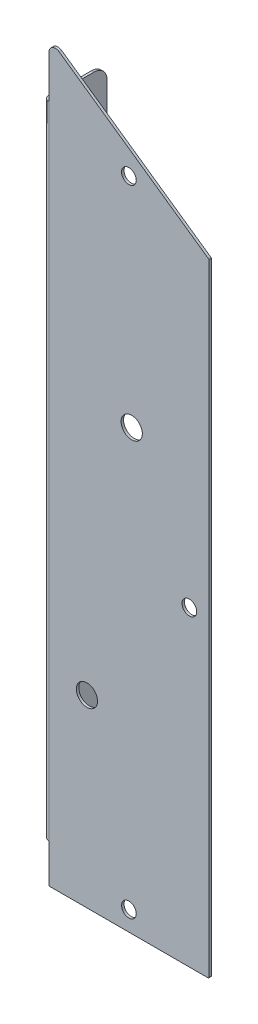
from build123d import *

# Parameters (mm, degrees)
BASE_FLANGE1_DEPTH  = 1.1938
MITER_START         = -132.310053061
MITER_FLANGE1_DEPTH = 311.15
FILLET2_R           = 3.175
CUT_EXTRUDE1_REACH  = 211.249
SKETCH12_R          = 3.571875
SKETCH13_R          = 5.159375
CUT_EXTRUDE2_DEPTH  = 210.249492514
FILLET3_R           = 6.35
FILLET4_R           = 0.396875


# Read off the part's stored shape, not the designer's step: Miter Flange1
# Sheet-metal steps are written as plain solids
with BuildPart() as part:
    # Sketch1 → Base-Flange1 (new body)
    with BuildSketch(Plane.XY):
        Polygon((-38.89375, -151.360053061), (38.89375, -151.360053061), (38.89375, 151.360053061), (-38.89375, 205.827446939), (-38.89375, 151.360053061), align=None)
    extrude(amount=-BASE_FLANGE1_DEPTH)

    # Miter Flange1 outline → Miter Flange1 (add)
    with BuildSketch(Plane(origin=(0, 0, 0), x_dir=(1, 0, 0), z_dir=(0, 1, 0)).offset(MITER_START)):
        with BuildLine():
            Line((-40.39235, 29.7688), (-41.58615, 29.7688))
            Line((-41.58615, 29.7688), (-41.58615, 2.6924))
            ThreePointArc((-41.58615, 2.6924), (-40.797564298, 0.788585702), (-38.89375, 0))
            Line((-38.89375, 0), (-38.89375, 1.1938))
            ThreePointArc((-38.89375, 1.1938), (-39.953420222, 1.632729778), (-40.39235, 2.6924))
            Line((-40.39235, 2.6924), (-40.39235, 29.7688))
        make_face()
    extrude(amount=MITER_FLANGE1_DEPTH)

    # Fillet2
    fillet2_edges = [part.edges().sort_by_distance(p)[0] for p in [
        (-38.89375, 205.827446939, -0.5969),
    ]]
    fillet(fillet2_edges, radius=FILLET2_R)

    # Sketch12 → Cut-Extrude1 (cut, up to next)
    with BuildSketch(Plane.XY, mode=Mode.PRIVATE) as cut_extrude1_sk1:
        with Locations((29.36875, 0)):
            Circle(SKETCH12_R)
    cut_extrude1_tool1 = extrude(cut_extrude1_sk1.sketch, amount=-CUT_EXTRUDE1_REACH, mode=Mode.PRIVATE) & part.part
    # Sketch12 → Cut-Extrude1 (cut, up to next)
    with BuildSketch(Plane.XY, mode=Mode.PRIVATE) as cut_extrude1_sk2:
        with Locations((0, -141.835053061)):
            Circle(SKETCH12_R)
    cut_extrude1_tool2 = extrude(cut_extrude1_sk2.sketch, amount=-CUT_EXTRUDE1_REACH, mode=Mode.PRIVATE) & part.part
    # Sketch12 → Cut-Extrude1 (cut, up to next)
    with BuildSketch(Plane.XY, mode=Mode.PRIVATE) as cut_extrude1_sk3:
        with Locations((0, 166.965872042)):
            Circle(SKETCH12_R)
    cut_extrude1_tool3 = extrude(cut_extrude1_sk3.sketch, amount=-CUT_EXTRUDE1_REACH, mode=Mode.PRIVATE) & part.part
    add(cut_extrude1_tool1.solids().sort_by_distance((29.36875, 0, 0))[0], mode=Mode.SUBTRACT)
    add(cut_extrude1_tool2.solids().sort_by_distance((0, -141.835053, 0))[0], mode=Mode.SUBTRACT)
    add(cut_extrude1_tool3.solids().sort_by_distance((0, 166.965872, 0))[0], mode=Mode.SUBTRACT)

    # Sketch13 → Cut-Extrude2 (cut, through all)
    with BuildSketch(Plane.XY):
        with Locations((1.363826041, 61.753601162)):
            Circle(SKETCH13_R)
        with Locations((-20.413826041, -61.753601162)):
            Circle(SKETCH13_R)
    extrude(amount=-CUT_EXTRUDE2_DEPTH, mode=Mode.SUBTRACT)

    # Fillet3
    fillet3_edges = [part.edges().sort_by_distance(p)[0] for p in [
        (-40.98925, -132.310053061, -29.7688),
        (-40.98925, 178.839946939, -29.7688),
    ]]
    fillet(fillet3_edges, radius=FILLET3_R)

    # Fillet4
    # the kernel refuses this fillet: 0.396875 mm, written as the material it adds along each edge
    with BuildSketch(Plane(origin=(-38.89375, -132.310053061, 0.9921875), x_dir=(-1, 0, 0), z_dir=(0, 0, -1))) as fillet4_piece_1_section:
        with BuildLine():
            CenterArc((FILLET4_R, -FILLET4_R), FILLET4_R, 90, 90)
            Line((0, -FILLET4_R), (0, 0))
            Line((0, 0), (FILLET4_R, 0))
        make_face()
    fillet4_piece_1 = extrude(amount=3.178175, mode=Mode.PRIVATE)
    fillet4_piece_1 = fillet4_piece_1 & Plane(origin=(-38.893750001, -132.398815537, -2.692399999), x_dir=(-1.0, 0, -4.2270187104329246e-10), z_dir=(0, -1, 0)) * Cylinder(2.692399999, 8, mode=Mode.PRIVATE)
    fillet4_piece_1 = fillet4_piece_1 - Plane(origin=(-38.893749999, -132.398815537, -2.692400001), x_dir=(-6.519535415155748e-10, 0, 1.0), z_dir=(0, -1, 0)) * Cylinder(1.498600001, 8, mode=Mode.PRIVATE)
    add(fillet4_piece_1)
    with BuildSketch(Plane(origin=(-38.89375, 178.839946939, 0.9921875), x_dir=(-1, 0, 0), z_dir=(0, 0, -1))) as fillet4_piece_2_section:
        with BuildLine():
            CenterArc((FILLET4_R, FILLET4_R), FILLET4_R, 180, 90)
            Line((0, FILLET4_R), (0, 0))
            Line((0, 0), (FILLET4_R, 0))
        make_face()
    fillet4_piece_2 = extrude(amount=3.178175, mode=Mode.PRIVATE)
    fillet4_piece_2 = fillet4_piece_2 & Plane(origin=(-38.893750001, 178.928709436, -2.692399999), x_dir=(-1.0, 0, -4.2270187104329246e-10), z_dir=(0, -1, 0)) * Cylinder(2.692399999, 8, mode=Mode.PRIVATE)
    fillet4_piece_2 = fillet4_piece_2 - Plane(origin=(-38.893749999, 178.928709436, -2.692400001), x_dir=(-6.519535415155748e-10, 0, 1.0), z_dir=(0, -1, 0)) * Cylinder(1.498600001, 8, mode=Mode.PRIVATE)
    add(fillet4_piece_2)
    # the kernel refuses this fillet: 0.396875 mm, written as the material it takes off along each edge
    with BuildSketch(Plane(origin=(38.89375, 151.360053061, 0.51650012), x_dir=(0, -1, 0), z_dir=(0, 0, -1))) as fillet4_2_piece_1:
        with BuildLine():
            CenterArc((FILLET4_R * 0.520567050552, FILLET4_R), FILLET4_R, 215, 55)
            Line((-FILLET4_R * 0.298584993737, FILLET4_R * 0.426423563649), (0, 0))
            Line((0, 0), (FILLET4_R * 0.520567050552, 0))
        make_face()
    extrude(amount=2.226800241, mode=Mode.SUBTRACT)
    with BuildSketch(Plane(origin=(38.89375, -151.360053061, 0.9921875), x_dir=(0, 1, 0), z_dir=(0, 0, -1))) as fillet4_2_piece_2:
        with BuildLine():
            CenterArc((FILLET4_R, -FILLET4_R), FILLET4_R, 90, 90)
            Line((0, -FILLET4_R), (0, 0))
            Line((0, 0), (FILLET4_R, 0))
        make_face()
    extrude(amount=3.178175, mode=Mode.SUBTRACT)
    with BuildSketch(Plane(origin=(-38.89375, -151.360053061, 0.9921875), x_dir=(0, 1, 0), z_dir=(0, 0, -1))) as fillet4_2_piece_3:
        with BuildLine():
            CenterArc((FILLET4_R, FILLET4_R), FILLET4_R, 180, 90)
            Line((0, FILLET4_R), (0, 0))
            Line((0, 0), (FILLET4_R, 0))
        make_face()
    extrude(amount=3.178175, mode=Mode.SUBTRACT)


solid = part.part
